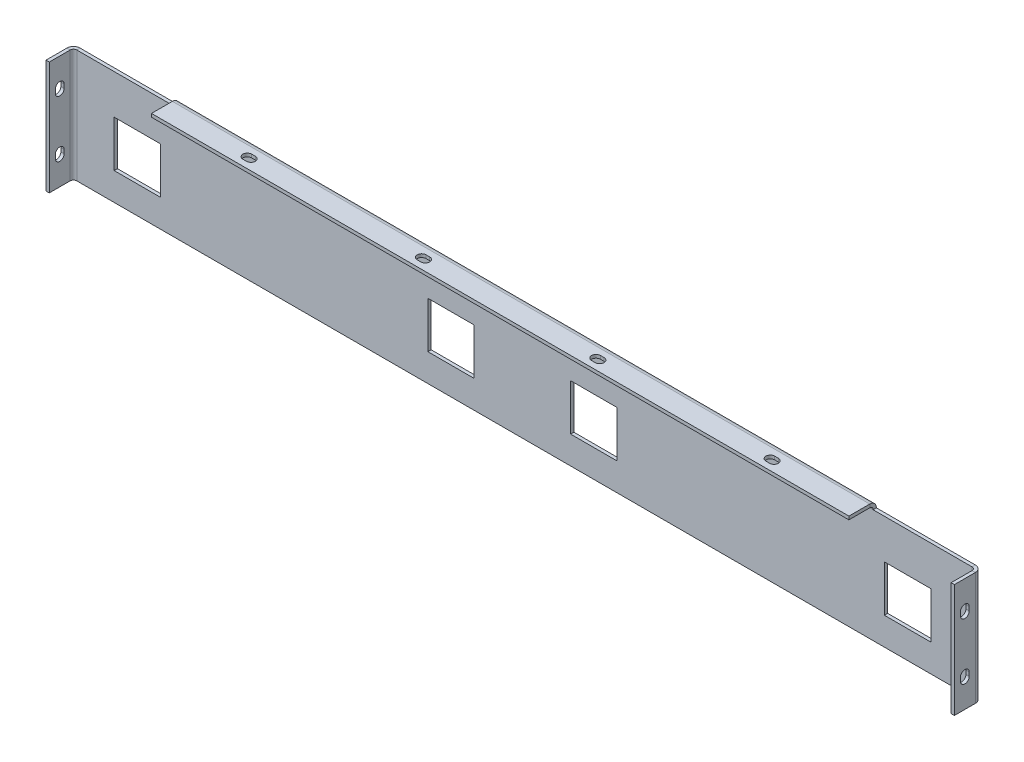
from build123d import *

# Parameters (mm, degrees)
SKETCH1_W                      = 629.90984
SKETCH1_H                      = 78.62062
SKETCH1_W_2                    = 32.08
SKETCH1_H_2                    = 32.08
SKETCH1_W_3                    = 32.277504859
SKETCH1_H_3                    = 32.079999999
SKETCH1_W_4                    = 32.400630989
BASE_FLANGE1_DEPTH             = 2.286
EDGE_FLANGE1_STRIP_W           = 13.716
EDGE_FLANGE1_STRIP_H           = 2.286
EDGE_FLANGE1_STRIP_CUT_DEPTH   = 78.62062
EDGE_FLANGE1_STRIP_2_W         = 13.716
EDGE_FLANGE1_STRIP_2_H         = 2.286
EDGE_FLANGE1_STRIP_CUT_2_DEPTH = 78.62062
EDGE_FLANGE1_DEPTH             = 78.62062
EDGE_FLANGE1_BEND_DEPTH        = 78.62062
EDGE_FLANGE2_DEPTH             = 483.60584
CUT_EXTRUDE2_DEPTH             = 719.802540597
CUT_EXTRUDE3_DEPTH             = 891.094678327


# Sheet-metal steps are written as plain solids
with BuildPart() as part:
    # Sketch1 → Base-Flange1 (new body)
    with BuildSketch(Plane.XY):
        with Locations((-571.296524868, -306.535976872)):
            Rectangle(SKETCH1_W, SKETCH1_H)
        with Locations((-839.718644868, -310.649506872)):
            Rectangle(SKETCH1_W_2, SKETCH1_H_2, mode=Mode.SUBTRACT)
        with Locations((-622.144784868, -310.649506872)):
            Rectangle(SKETCH1_W_2, SKETCH1_H_2, mode=Mode.SUBTRACT)
        with Locations((-523.077472438, -310.649506873)):
            Rectangle(SKETCH1_W_3, SKETCH1_H_3, mode=Mode.SUBTRACT)
        with Locations((-305.442049373, -310.649506872)):
            Rectangle(SKETCH1_W_4, SKETCH1_H_2, mode=Mode.SUBTRACT)
    extrude(amount=-BASE_FLANGE1_DEPTH)

    # Edge-Flange1 strip (across the edge) → Edge-Flange1 strip cut (cut)
    with BuildSketch(Plane(origin=(-256.341604868, -345.846286872, 0), x_dir=(-1, 0, 0), z_dir=(0, 1, 0))):
        with Locations((-2.286, -1.143)):
            Rectangle(EDGE_FLANGE1_STRIP_W, EDGE_FLANGE1_STRIP_H)
    extrude(amount=EDGE_FLANGE1_STRIP_CUT_DEPTH, mode=Mode.SUBTRACT)

    # Edge-Flange1 strip 2 (across the edge) → Edge-Flange1 strip cut 2 (cut)
    with BuildSketch(Plane(origin=(-886.251444868, -267.225666872, 0), x_dir=(1, 0, 0), z_dir=(0, -1, 0))):
        with Locations((-2.286, -1.143)):
            Rectangle(EDGE_FLANGE1_STRIP_2_W, EDGE_FLANGE1_STRIP_2_H)
    extrude(amount=EDGE_FLANGE1_STRIP_CUT_2_DEPTH, mode=Mode.SUBTRACT)

    # Edge-Flange1 section (across the edge) → Edge-Flange1 (add)
    with BuildSketch(Plane(origin=(-256.341604868, -345.846286872, 0), x_dir=(-1, 0, 0), z_dir=(0, 1, 0))):
        with BuildLine():
            Line((0, 2.286), (0, 16.764))
            Line((0, 16.764), (2.286, 16.764))
            Line((2.286, 16.764), (2.286, 2.286))
            ThreePointArc((2.286, 2.286), (2.955553898, 0.669553898), (4.572, 0))
            Line((4.572, 0), (4.572, -2.286))
            ThreePointArc((4.572, -2.286), (1.339107796, -0.946892204), (0, 2.286))
        make_face()
    extrude(amount=EDGE_FLANGE1_DEPTH)

    # Edge-Flange1 section 2 (across the edge) → Edge-Flange1 bend (add)
    with BuildSketch(Plane(origin=(-886.251444868, -267.225666872, 0), x_dir=(1, 0, 0), z_dir=(0, -1, 0))):
        with BuildLine():
            Line((0, 2.286), (0, 16.764))
            Line((0, 16.764), (2.286, 16.764))
            Line((2.286, 16.764), (2.286, 2.286))
            ThreePointArc((2.286, 2.286), (2.955553898, 0.669553898), (4.572, 0))
            Line((4.572, 0), (4.572, -2.286))
            ThreePointArc((4.572, -2.286), (1.339107796, -0.946892204), (0, 2.286))
        make_face()
    extrude(amount=EDGE_FLANGE1_BEND_DEPTH)

    # Edge-Flange2 section (across the edge) → Edge-Flange2 (add)
    with BuildSketch(Plane(origin=(-329.493604868, -264.939666872, 0), x_dir=(0, -1, 0), z_dir=(-1, 0, 0))):
        with BuildLine():
            Line((-2.286, 2.286), (-2.286, 16.764))
            Line((-2.286, 16.764), (0, 16.764))
            Line((0, 16.764), (0, 2.286))
            ThreePointArc((0, 2.286), (0.669553898, 0.669553898), (2.286, 0))
            Line((2.286, 0), (2.286, -2.286))
            ThreePointArc((2.286, -2.286), (-0.946892204, -0.946892204), (-2.286, 2.286))
        make_face()
    extrude(amount=EDGE_FLANGE2_DEPTH)

    # Sketch26 → Cut-Extrude2 (cut, through all)
    with BuildSketch(Plane.ZY.offset(886.251444868)):
        with BuildLine():
            Line((12.575, -285.610821872), (12.575, -288.150821872))
            ThreePointArc((12.575, -288.150821872), (9.525, -291.200821872), (6.475, -288.150821872))
            Line((6.475, -288.150821872), (6.475, -285.610821872))
            ThreePointArc((6.475, -285.610821872), (9.525, -282.560821872), (12.575, -285.610821872))
        make_face()
        with BuildLine():
            Line((12.575, -327.461131872), (12.575, -324.921131872))
            ThreePointArc((12.575, -324.921131872), (9.525, -321.871131872), (6.475, -324.921131872))
            Line((6.475, -324.921131872), (6.475, -327.461131872))
            ThreePointArc((6.475, -327.461131872), (9.525, -330.511131872), (12.575, -327.461131872))
        make_face()
    extrude(amount=-CUT_EXTRUDE2_DEPTH, mode=Mode.SUBTRACT)

    # Sketch27 → Cut-Extrude3 (cut, through all)
    with BuildSketch(Plane.XZ.offset(264.939666872)):
        with BuildLine():
            Line((-753.918714868, 12.575), (-751.378714868, 12.575))
            ThreePointArc((-751.378714868, 12.575), (-748.328714868, 9.525), (-751.378714868, 6.475))
            Line((-751.378714868, 6.475), (-753.918714868, 6.475))
            ThreePointArc((-753.918714868, 6.475), (-756.968714868, 9.525), (-753.918714868, 12.575))
        make_face()
        with BuildLine():
            Line((-630.477254868, 12.575), (-633.017254868, 12.575))
            ThreePointArc((-633.017254868, 12.575), (-636.067254868, 9.525), (-633.017254868, 6.475))
            Line((-633.017254868, 6.475), (-630.477254868, 6.475))
            ThreePointArc((-630.477254868, 6.475), (-627.427254868, 9.525), (-630.477254868, 12.575))
        make_face()
        with BuildLine():
            Line((-388.674334868, 12.575), (-391.214334868, 12.575))
            ThreePointArc((-391.214334868, 12.575), (-394.264334868, 9.525), (-391.214334868, 6.475))
            Line((-391.214334868, 6.475), (-388.674334868, 6.475))
            ThreePointArc((-388.674334868, 6.475), (-385.624334868, 9.525), (-388.674334868, 12.575))
        make_face()
        with BuildLine():
            Line((-512.115794868, 12.575), (-509.575794868, 12.575))
            ThreePointArc((-509.575794868, 12.575), (-506.525794868, 9.525), (-509.575794868, 6.475))
            Line((-509.575794868, 6.475), (-512.115794868, 6.475))
            ThreePointArc((-512.115794868, 6.475), (-515.165794868, 9.525), (-512.115794868, 12.575))
        make_face()
    extrude(amount=-CUT_EXTRUDE3_DEPTH, mode=Mode.SUBTRACT)


solid = part.part
